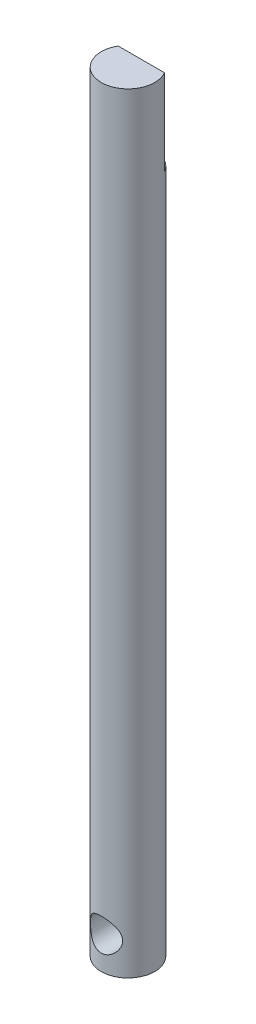
from build123d import *

# Parameters (mm, degrees)
SKETCH1_R               = 3.96875
BOSS_EXTRUDE1_DEPTH     = 114.3
CUT_EXTRUDE1_DEPTH      = 12.7
CUT_EXTRUDE2_DEPTH      = 12.7
CUT_EXTRUDE2_DEPTH_BACK = 12.7
SKETCH3_R               = 2.38125


with BuildPart() as part:
    # Sketch1 → Boss-Extrude1 (new body)
    with BuildSketch(Plane(origin=(0, 0, 0), x_dir=(1, 0, 0), z_dir=(0, 1, 0))):
        Circle(SKETCH1_R)
    extrude(amount=BOSS_EXTRUDE1_DEPTH)

    # Sketch2 → Cut-Extrude1 (cut)
    with BuildSketch(Plane(origin=(0, 114.3, 0), x_dir=(1, 0, 0), z_dir=(0, 1, 0))):
        Polygon((3.437038321, 1.984375), (-3.437038321, 1.984375), (-4.719395918, 2.522465653), (-2.590204502, 6.353236507), (2.456720437, 4.728926773), align=None)
    extrude(amount=-CUT_EXTRUDE1_DEPTH, mode=Mode.SUBTRACT)

    # Sketch3 → Cut-Extrude2 (cut, two sides: drawn at the far end of the back side and taken through both)
    with BuildSketch(Plane(origin=(0, 0, -1.984375), x_dir=(-1, 0, 0), z_dir=(0, 0, -1)).offset(-CUT_EXTRUDE2_DEPTH_BACK)):
        with Locations((0, 4.7625)):
            Circle(SKETCH3_R)
    extrude(amount=CUT_EXTRUDE2_DEPTH + CUT_EXTRUDE2_DEPTH_BACK, mode=Mode.SUBTRACT)


solid = part.part
